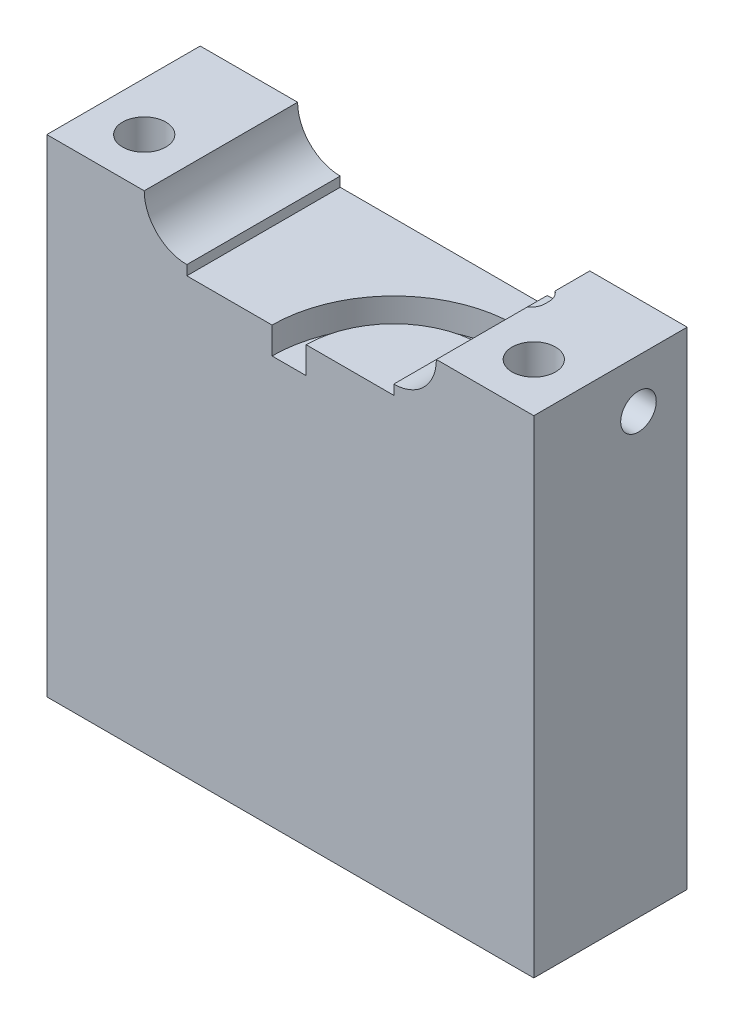
from build123d import *

# Parameters (mm, degrees)
SKETCH1_W                 = 25.4
SKETCH1_H                 = 8.001
BOSS_EXTRUDE1_DEPTH       = 25.4
CUT_EXTRUDE1_DEPTH        = 25.4
CUT_EXTRUDE2_DEPTH        = 27.729955228
CUT_EXTRUDE2_DEPTH_BACK   = 1.905
SKETCH5_R                 = 0.9271
CUT_EXTRUDE3_DEPTH        = 6.35
SKETCH6_W                 = 10.795
SKETCH6_H                 = 8.001
CUT_EXTRUDE4_DEPTH        = 0.508
F_4_40_TAPPED_HOLE1_D     = 2.2606
F_4_40_TAPPED_HOLE1_DEPTH = 10.922
F_4_40_TAPPED_HOLE1_TIP   = 0.679152758


with BuildPart() as part:
    # Sketch1 → Boss-Extrude1 (new body)
    with BuildSketch(Plane(origin=(0, 0, 0), x_dir=(1, 0, 0), z_dir=(0, 1, 0))):
        Rectangle(SKETCH1_W, SKETCH1_H)
    extrude(amount=BOSS_EXTRUDE1_DEPTH)

    # Sketch2 → Cut-Extrude1 (cut)
    with BuildSketch(Plane(origin=(0, 0, -4.0005), x_dir=(-1, 0, 0), z_dir=(0, 0, -1))):
        with BuildLine():
            Line((5.3975, 23.1775), (-5.3975, 23.1775))
            ThreePointArc((-5.3975, 23.1775), (-7.62, 25.4), (-5.3975, 27.6225))
            Line((-5.3975, 27.6225), (5.3975, 27.6225))
            ThreePointArc((5.3975, 27.6225), (7.62, 25.4), (5.3975, 23.1775))
        make_face()
    extrude(amount=-CUT_EXTRUDE1_DEPTH, mode=Mode.SUBTRACT)

    # Sketch4 → Cut-Extrude2 (cut, two sides: drawn at the far end of the back side and taken through both)
    with BuildSketch(Plane(origin=(0, 23.1775, 0), x_dir=(1, 0, 0), z_dir=(0, 1, 0)).offset(-CUT_EXTRUDE2_DEPTH_BACK)):
        with BuildLine():
            Line((0.8255, -4.0005), (-0.9525, -4.0005))
            ThreePointArc((-0.9525, -4.0005), (0.907371939, 0.489628061), (5.3975, 2.3495))
            Line((5.3975, 2.3495), (7.14375, 2.3495))
            ThreePointArc((7.14375, 2.3495), (7.705016008, 2.117016008), (7.9375, 1.55575))
            Line((7.9375, 1.55575), (7.9375, 1.36525))
            ThreePointArc((7.9375, 1.36525), (7.705016008, 0.803983992), (7.14375, 0.5715))
            Line((7.14375, 0.5715), (5.3975, 0.5715))
            ThreePointArc((5.3975, 0.5715), (2.164607796, -0.767607796), (0.8255, -4.0005))
        make_face()
    extrude(amount=CUT_EXTRUDE2_DEPTH + CUT_EXTRUDE2_DEPTH_BACK, mode=Mode.SUBTRACT)

    # Sketch5 → Cut-Extrude3 (cut)
    with BuildSketch(Plane(origin=(12.7, 0, 0), x_dir=(0, 0, -1), z_dir=(1, 0, 0))):
        with Locations((1.4605, 22.86)):
            Circle(SKETCH5_R)
    extrude(amount=-CUT_EXTRUDE3_DEPTH, mode=Mode.SUBTRACT)

    # Sketch6 → Cut-Extrude4 (cut)
    with BuildSketch(Plane(origin=(0, 23.1775, 0), x_dir=(1, 0, 0), z_dir=(0, 1, 0))):
        Rectangle(SKETCH6_W, SKETCH6_H)
    extrude(amount=-CUT_EXTRUDE4_DEPTH, mode=Mode.SUBTRACT)

    # #4-40 Tapped Hole1
    with Locations(Plane(origin=(0, 25.4, 0), x_dir=(1, 0, 0), z_dir=(0, 1, 0))):
        with Locations((-10.16, -1.4605), (10.16, -1.4605)):
            Hole(F_4_40_TAPPED_HOLE1_D / 2, depth=F_4_40_TAPPED_HOLE1_DEPTH)
            with Locations((0, 0, -(F_4_40_TAPPED_HOLE1_DEPTH + F_4_40_TAPPED_HOLE1_TIP / 2))):  # 118° drill point
                Cone(0, F_4_40_TAPPED_HOLE1_D / 2, F_4_40_TAPPED_HOLE1_TIP, mode=Mode.SUBTRACT)


solid = part.part
